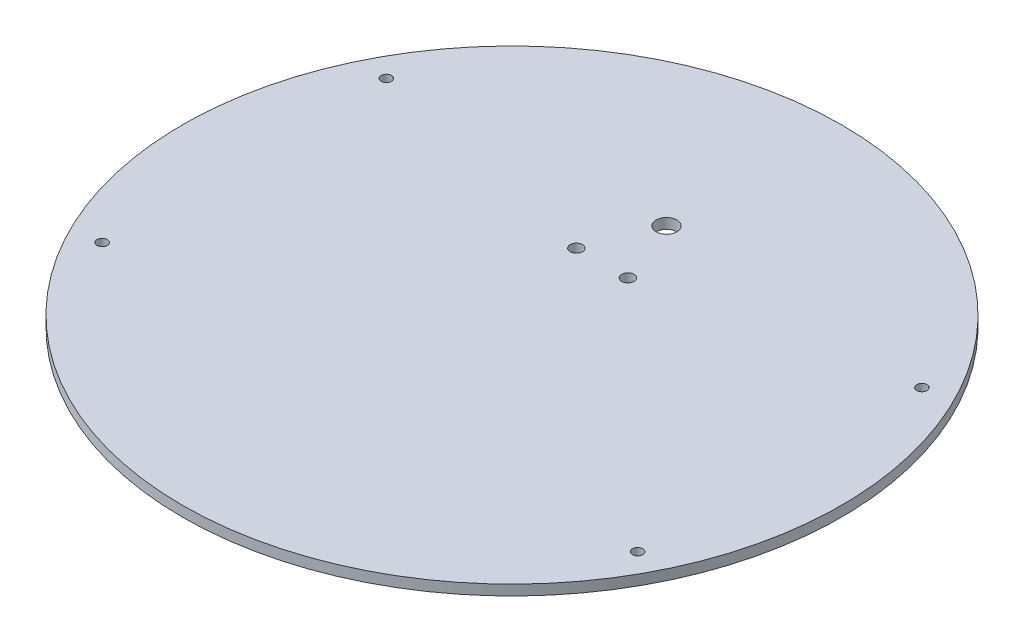
from build123d import *

# Parameters (mm, degrees)
SKETCH1_R           = 101.6
BOSS_EXTRUDE1_DEPTH = 3.175
CUT_EXTRUDE1_REACH  = 145.719
SKETCH2_R           = 1.5875
CUT_EXTRUDE2_REACH  = 145.719
SKETCH3_R           = 3.175
CUT_EXTRUDE3_REACH  = 145.719
SKETCH4_R           = 1.905


with BuildPart() as part:
    # Sketch1 → Boss-Extrude1 (new body)
    with BuildSketch(Plane(origin=(0, 0, 0), x_dir=(1, 0, 0), z_dir=(0, 1, 0))):
        Circle(SKETCH1_R)
    extrude(amount=BOSS_EXTRUDE1_DEPTH)

    # Sketch2 → Cut-Extrude1 (cut, up to next)
    with BuildSketch(Plane(origin=(0, 3.175, 0), x_dir=(1, 0, 0), z_dir=(0, 1, 0)), mode=Mode.PRIVATE) as cut_extrude1_sk1:
        with Locations((-82.55, 43.815)):
            Circle(SKETCH2_R)
    cut_extrude1_tool1 = extrude(cut_extrude1_sk1.sketch, amount=-CUT_EXTRUDE1_REACH, mode=Mode.PRIVATE) & part.part
    # Sketch2 → Cut-Extrude1 (cut, up to next)
    with BuildSketch(Plane(origin=(0, 3.175, 0), x_dir=(1, 0, 0), z_dir=(0, 1, 0)), mode=Mode.PRIVATE) as cut_extrude1_sk2:
        with Locations((82.55, 43.815)):
            Circle(SKETCH2_R)
    cut_extrude1_tool2 = extrude(cut_extrude1_sk2.sketch, amount=-CUT_EXTRUDE1_REACH, mode=Mode.PRIVATE) & part.part
    # Sketch2 → Cut-Extrude1 (cut, up to next)
    with BuildSketch(Plane(origin=(0, 3.175, 0), x_dir=(1, 0, 0), z_dir=(0, 1, 0)), mode=Mode.PRIVATE) as cut_extrude1_sk3:
        with Locations((-82.55, -43.815)):
            Circle(SKETCH2_R)
    cut_extrude1_tool3 = extrude(cut_extrude1_sk3.sketch, amount=-CUT_EXTRUDE1_REACH, mode=Mode.PRIVATE) & part.part
    # Sketch2 → Cut-Extrude1 (cut, up to next)
    with BuildSketch(Plane(origin=(0, 3.175, 0), x_dir=(1, 0, 0), z_dir=(0, 1, 0)), mode=Mode.PRIVATE) as cut_extrude1_sk4:
        with Locations((82.55, -43.815)):
            Circle(SKETCH2_R)
    cut_extrude1_tool4 = extrude(cut_extrude1_sk4.sketch, amount=-CUT_EXTRUDE1_REACH, mode=Mode.PRIVATE) & part.part
    add(cut_extrude1_tool1.solids().sort_by_distance((-82.55, 3.175, -43.815))[0], mode=Mode.SUBTRACT)
    add(cut_extrude1_tool2.solids().sort_by_distance((82.55, 3.175, -43.815))[0], mode=Mode.SUBTRACT)
    add(cut_extrude1_tool3.solids().sort_by_distance((-82.55, 3.175, 43.815))[0], mode=Mode.SUBTRACT)
    add(cut_extrude1_tool4.solids().sort_by_distance((82.55, 3.175, 43.815))[0], mode=Mode.SUBTRACT)

    # Sketch3 → Cut-Extrude2 (cut, up to next)
    with BuildSketch(Plane(origin=(0, 3.175, 0), x_dir=(1, 0, 0), z_dir=(0, 1, 0)), mode=Mode.PRIVATE) as cut_extrude2_sk1:
        with Locations((0, 47.625)):
            Circle(SKETCH3_R)
    cut_extrude2_tool1 = extrude(cut_extrude2_sk1.sketch, amount=-CUT_EXTRUDE2_REACH, mode=Mode.PRIVATE) & part.part
    add(cut_extrude2_tool1.solids().sort_by_distance((0, 3.175, -47.625))[0], mode=Mode.SUBTRACT)

    # Sketch4 → Cut-Extrude3 (cut, up to next)
    with BuildSketch(Plane.XZ, mode=Mode.PRIVATE) as cut_extrude3_sk1:
        with Locations((-7.937499997, -27.781250051)):
            Circle(SKETCH4_R)
    cut_extrude3_tool1 = extrude(cut_extrude3_sk1.sketch, amount=-CUT_EXTRUDE3_REACH, mode=Mode.PRIVATE) & part.part
    # Sketch4 → Cut-Extrude3 (cut, up to next)
    with BuildSketch(Plane.XZ, mode=Mode.PRIVATE) as cut_extrude3_sk2:
        with Locations((7.937500003, -27.781250051)):
            Circle(SKETCH4_R)
    cut_extrude3_tool2 = extrude(cut_extrude3_sk2.sketch, amount=-CUT_EXTRUDE3_REACH, mode=Mode.PRIVATE) & part.part
    add(cut_extrude3_tool1.solids().sort_by_distance((-7.9375, 0, -27.78125))[0], mode=Mode.SUBTRACT)
    add(cut_extrude3_tool2.solids().sort_by_distance((7.9375, 0, -27.78125))[0], mode=Mode.SUBTRACT)


solid = part.part
